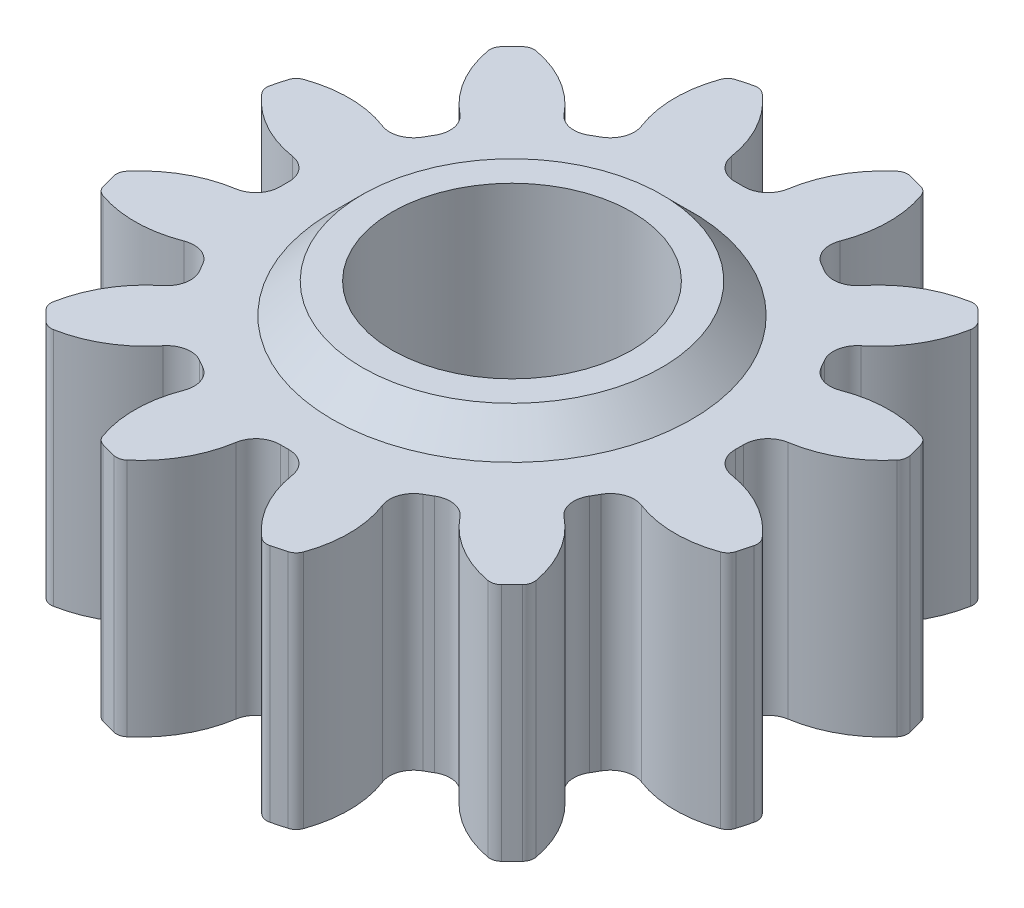
from build123d import *

# Parameters (mm, degrees)
SKETCH1_R            = 5.5
SKETCH1_R_2          = 2
BOSS_EXTRUDE1_DEPTH  = 4
CUT_EXTRUDE1_DEPTH   = 4
FILLET1_R            = 0.2
FILLET2_R            = 0.4
FILLET1_OF_MIRROR1_R = 0.2
FILLET2_OF_MIRROR1_R = 0.4
CIRPATTERN1_DEPTH    = 4
SKETCH3_R            = 3
SKETCH3_R_2          = 2
BOSS_EXTRUDE2_DEPTH  = 0.5
CHAMFER1_SIZE        = 0.5
BOSS_EXTRUDE3_START  = 0.5
SKETCH4_R            = 3
SKETCH4_R_2          = 2
BOSS_EXTRUDE3_DEPTH  = 0.5
CHAMFER2_SIZE        = 0.5


# Read off the part's stored shape, not the designer's step: CirPattern1
with BuildPart() as part:
    # Sketch1 → Boss-Extrude1 (new body)
    with BuildSketch(Plane(origin=(0, 0, 0), x_dir=(1, 0, 0), z_dir=(0, 1, 0))):
        with Locations(Location((0, 0, 0), (0, 0, 270))):
            Circle(SKETCH1_R)
        with Locations(Location((0, 0, 0), (0, 0, 270))):
            Circle(SKETCH1_R_2, mode=Mode.SUBTRACT)
    extrude(amount=BOSS_EXTRUDE1_DEPTH)

    # Sketch2 → Cut-Extrude1 (cut)
    with BuildSketch(Plane(origin=(0, 4, 0), x_dir=(1, 0, 0), z_dir=(0, 1, 0))):
        with BuildLine():
            Line((0, 3.799), (0, 7.477315916))
            Line((0, 7.477315916), (-1.717756705, 5.644784223))
            ThreePointArc((-1.717756705, 5.644784223), (-0.778860554, 4.915006115), (-0.449816676, 3.772275965))
            ThreePointArc((-0.449816676, 3.772275965), (-0.225304913, 3.792313106), (0, 3.799))
        make_face()
    cut_extrude1 = extrude(amount=-CUT_EXTRUDE1_DEPTH, mode=Mode.SUBTRACT)

    # Fillet1
    fillet1_edges = [part.edges().sort_by_distance(p)[0] for p in [
        (-1.205722077, 2, -5.366212284),
    ]]
    fillet(fillet1_edges, radius=FILLET1_R)

    # Fillet2
    fillet2_edges = [part.edges().sort_by_distance(p)[0] for p in [
        (-0.449816676, 2, -3.772275965),
    ]]
    fillet(fillet2_edges, radius=FILLET2_R)

    # Mirror1: Cut-Extrude1 across plane
    add(cut_extrude1.mirror(Plane.ZY), mode=Mode.SUBTRACT)

    # Fillet1 of Mirror1
    fillet1_of_mirror1_edges = [part.edges().sort_by_distance(p)[0] for p in [
        (1.205722077, 2, -5.366212284),
    ]]
    fillet(fillet1_of_mirror1_edges, radius=FILLET1_OF_MIRROR1_R)

    # Fillet2 of Mirror1
    fillet2_of_mirror1_edges = [part.edges().sort_by_distance(p)[0] for p in [
        (0.449816676, 2, -3.772275965),
    ]]
    fillet(fillet2_of_mirror1_edges, radius=FILLET2_OF_MIRROR1_R)

    # CirPattern1 outline → CirPattern1 (cut)
    with BuildSketch(Plane(origin=(0, 0, 0), x_dir=(1, 0, 0), z_dir=(0, 1, 0))):
        with BuildLine():
            ThreePointArc((3.62556251, 4.028637884), (3.71888228, 4.023485264), (3.799671329, 3.976493152))
            ThreePointArc((3.799671329, 3.976493152), (2.75, 4.76313972), (1.543908423, 5.278858473))
            ThreePointArc((1.543908423, 5.278858473), (1.62499931, 5.23238916), (1.676121495, 5.154148179))
            ThreePointArc((1.676121495, 5.154148179), (1.787762124, 4.48460755), (1.659448371, 3.81806133))
            ThreePointArc((1.659448371, 3.81806133), (1.656771541, 3.537498856), (1.839050027, 3.32419855))
            ThreePointArc((1.839050027, 3.32419855), (1.8995, 3.290030509), (1.959315378, 3.254763317))
            ThreePointArc((1.959315378, 3.254763317), (2.235178105, 3.203555671), (2.47681392, 3.34615511))
            ThreePointArc((2.47681392, 3.34615511), (2.989903003, 3.79055119), (3.62556251, 4.028637884))
        make_face()
        with BuildLine():
            ThreePointArc((5.154148179, 1.676121495), (5.23238916, 1.62499931), (5.278858473, 1.543908423))
            ThreePointArc((5.278858473, 1.543908423), (4.763139721, 2.75), (3.976493152, 3.799671329))
            ThreePointArc((3.976493152, 3.799671329), (4.023485264, 3.71888228), (4.028637884, 3.62556251))
            ThreePointArc((4.028637884, 3.62556251), (3.79055119, 2.989903003), (3.34615511, 2.47681392))
            ThreePointArc((3.34615511, 2.47681392), (3.203555671, 2.235178105), (3.254763317, 1.959315378))
            ThreePointArc((3.254763317, 1.959315378), (3.290030509, 1.8995), (3.32419855, 1.839050027))
            ThreePointArc((3.32419855, 1.839050027), (3.537498856, 1.656771541), (3.81806133, 1.659448371))
            ThreePointArc((3.81806133, 1.659448371), (4.48460755, 1.787762124), (5.154148179, 1.676121495))
        make_face()
        with BuildLine():
            ThreePointArc((5.301684005, -1.125510295), (5.34388159, -1.208903897), (5.343579752, -1.302365321))
            ThreePointArc((5.343579752, -1.302365321), (5.5, 0), (5.343579752, 1.302365321))
            ThreePointArc((5.343579752, 1.302365321), (5.34388159, 1.208903897), (5.301684005, 1.125510295))
            ThreePointArc((5.301684005, 1.125510295), (4.777665126, 0.69405636), (4.13626229, 0.47190622))
            ThreePointArc((4.13626229, 0.47190622), (3.891949646, 0.333943185), (3.798365405, 0.069435233))
            ThreePointArc((3.798365405, 0.069435233), (3.799, 0), (3.798365405, -0.069435233))
            ThreePointArc((3.798365405, -0.069435233), (3.891949646, -0.333943185), (4.13626229, -0.47190622))
            ThreePointArc((4.13626229, -0.47190622), (4.777665126, -0.69405636), (5.301684005, -1.125510295))
        make_face()
        with BuildLine():
            ThreePointArc((4.028637884, -3.62556251), (4.023485264, -3.71888228), (3.976493152, -3.799671329))
            ThreePointArc((3.976493152, -3.799671329), (4.763139721, -2.75), (5.278858473, -1.543908423))
            ThreePointArc((5.278858473, -1.543908423), (5.23238916, -1.62499931), (5.154148179, -1.676121495))
            ThreePointArc((5.154148179, -1.676121495), (4.48460755, -1.787762124), (3.81806133, -1.659448371))
            ThreePointArc((3.81806133, -1.659448371), (3.537498856, -1.656771541), (3.32419855, -1.839050027))
            ThreePointArc((3.32419855, -1.839050027), (3.290030509, -1.8995), (3.254763317, -1.959315378))
            ThreePointArc((3.254763317, -1.959315378), (3.203555671, -2.235178105), (3.34615511, -2.47681392))
            ThreePointArc((3.34615511, -2.47681392), (3.79055119, -2.989903003), (4.028637884, -3.62556251))
        make_face()
        with BuildLine():
            ThreePointArc((1.676121495, -5.154148179), (1.62499931, -5.23238916), (1.543908423, -5.278858473))
            ThreePointArc((1.543908423, -5.278858473), (2.75, -4.763139721), (3.799671329, -3.976493152))
            ThreePointArc((3.799671329, -3.976493152), (3.71888228, -4.023485264), (3.62556251, -4.028637884))
            ThreePointArc((3.62556251, -4.028637884), (2.989903003, -3.79055119), (2.47681392, -3.34615511))
            ThreePointArc((2.47681392, -3.34615511), (2.235178105, -3.203555671), (1.959315378, -3.254763317))
            ThreePointArc((1.959315378, -3.254763317), (1.8995, -3.290030509), (1.839050027, -3.32419855))
            ThreePointArc((1.839050027, -3.32419855), (1.656771541, -3.537498856), (1.659448371, -3.81806133))
            ThreePointArc((1.659448371, -3.81806133), (1.787762124, -4.48460755), (1.676121495, -5.154148179))
        make_face()
        with BuildLine():
            ThreePointArc((-1.125510295, -5.301684005), (-1.208903897, -5.34388159), (-1.302365321, -5.343579752))
            ThreePointArc((-1.302365321, -5.343579752), (0, -5.5), (1.302365321, -5.343579752))
            ThreePointArc((1.302365321, -5.343579752), (1.208903897, -5.34388159), (1.125510295, -5.301684005))
            ThreePointArc((1.125510295, -5.301684005), (0.69405636, -4.777665126), (0.47190622, -4.13626229))
            ThreePointArc((0.47190622, -4.13626229), (0.333943185, -3.891949646), (0.069435233, -3.798365405))
            ThreePointArc((0.069435233, -3.798365405), (0, -3.799), (-0.069435233, -3.798365405))
            ThreePointArc((-0.069435233, -3.798365405), (-0.333943185, -3.891949646), (-0.47190622, -4.13626229))
            ThreePointArc((-0.47190622, -4.13626229), (-0.69405636, -4.777665126), (-1.125510295, -5.301684005))
        make_face()
        with BuildLine():
            ThreePointArc((-3.62556251, -4.028637884), (-3.71888228, -4.023485264), (-3.799671329, -3.976493152))
            ThreePointArc((-3.799671329, -3.976493152), (-2.75, -4.763139721), (-1.543908423, -5.278858473))
            ThreePointArc((-1.543908423, -5.278858473), (-1.62499931, -5.23238916), (-1.676121495, -5.154148179))
            ThreePointArc((-1.676121495, -5.154148179), (-1.787762124, -4.48460755), (-1.659448371, -3.81806133))
            ThreePointArc((-1.659448371, -3.81806133), (-1.656771541, -3.537498856), (-1.839050027, -3.32419855))
            ThreePointArc((-1.839050027, -3.32419855), (-1.8995, -3.290030509), (-1.959315378, -3.254763317))
            ThreePointArc((-1.959315378, -3.254763317), (-2.235178105, -3.203555671), (-2.47681392, -3.34615511))
            ThreePointArc((-2.47681392, -3.34615511), (-2.989903003, -3.79055119), (-3.62556251, -4.028637884))
        make_face()
        with BuildLine():
            ThreePointArc((-5.154148179, -1.676121495), (-5.23238916, -1.62499931), (-5.278858473, -1.543908423))
            ThreePointArc((-5.278858473, -1.543908423), (-4.763139721, -2.75), (-3.976493152, -3.799671329))
            ThreePointArc((-3.976493152, -3.799671329), (-4.023485264, -3.71888228), (-4.028637884, -3.62556251))
            ThreePointArc((-4.028637884, -3.62556251), (-3.79055119, -2.989903003), (-3.34615511, -2.47681392))
            ThreePointArc((-3.34615511, -2.47681392), (-3.203555671, -2.235178105), (-3.254763317, -1.959315378))
            ThreePointArc((-3.254763317, -1.959315378), (-3.290030509, -1.8995), (-3.32419855, -1.839050027))
            ThreePointArc((-3.32419855, -1.839050027), (-3.537498856, -1.656771541), (-3.81806133, -1.659448371))
            ThreePointArc((-3.81806133, -1.659448371), (-4.48460755, -1.787762124), (-5.154148179, -1.676121495))
        make_face()
        with BuildLine():
            ThreePointArc((-5.301684005, 1.125510295), (-5.34388159, 1.208903897), (-5.343579752, 1.302365321))
            ThreePointArc((-5.343579752, 1.302365321), (-5.5, 0), (-5.343579752, -1.302365321))
            ThreePointArc((-5.343579752, -1.302365321), (-5.34388159, -1.208903897), (-5.301684005, -1.125510295))
            ThreePointArc((-5.301684005, -1.125510295), (-4.777665126, -0.69405636), (-4.13626229, -0.47190622))
            ThreePointArc((-4.13626229, -0.47190622), (-3.891949646, -0.333943185), (-3.798365405, -0.069435233))
            ThreePointArc((-3.798365405, -0.069435233), (-3.799, 0), (-3.798365405, 0.069435233))
            ThreePointArc((-3.798365405, 0.069435233), (-3.891949646, 0.333943185), (-4.13626229, 0.47190622))
            ThreePointArc((-4.13626229, 0.47190622), (-4.777665126, 0.69405636), (-5.301684005, 1.125510295))
        make_face()
        with BuildLine():
            ThreePointArc((-4.028637884, 3.62556251), (-4.023485264, 3.71888228), (-3.976493152, 3.799671329))
            ThreePointArc((-3.976493152, 3.799671329), (-4.763139721, 2.75), (-5.278858473, 1.543908423))
            ThreePointArc((-5.278858473, 1.543908423), (-5.23238916, 1.62499931), (-5.154148179, 1.676121495))
            ThreePointArc((-5.154148179, 1.676121495), (-4.48460755, 1.787762124), (-3.81806133, 1.659448371))
            ThreePointArc((-3.81806133, 1.659448371), (-3.537498856, 1.656771541), (-3.32419855, 1.839050027))
            ThreePointArc((-3.32419855, 1.839050027), (-3.290030509, 1.8995), (-3.254763317, 1.959315378))
            ThreePointArc((-3.254763317, 1.959315378), (-3.203555671, 2.235178105), (-3.34615511, 2.47681392))
            ThreePointArc((-3.34615511, 2.47681392), (-3.79055119, 2.989903003), (-4.028637884, 3.62556251))
        make_face()
        with BuildLine():
            ThreePointArc((-1.959315378, 3.254763317), (-1.8995, 3.290030509), (-1.839050027, 3.32419855))
            ThreePointArc((-1.839050027, 3.32419855), (-1.656771541, 3.537498856), (-1.659448371, 3.81806133))
            ThreePointArc((-1.659448371, 3.81806133), (-1.787762124, 4.48460755), (-1.676121495, 5.154148179))
            ThreePointArc((-1.676121495, 5.154148179), (-1.62499931, 5.23238916), (-1.543908423, 5.278858473))
            ThreePointArc((-1.543908423, 5.278858473), (-2.75, 4.76313972), (-3.799671329, 3.976493152))
            ThreePointArc((-3.799671329, 3.976493152), (-3.71888228, 4.023485264), (-3.62556251, 4.028637884))
            ThreePointArc((-3.62556251, 4.028637884), (-2.989903003, 3.79055119), (-2.47681392, 3.34615511))
            ThreePointArc((-2.47681392, 3.34615511), (-2.235178105, 3.203555671), (-1.959315378, 3.254763317))
        make_face()
    extrude(amount=CIRPATTERN1_DEPTH, mode=Mode.SUBTRACT)

    # Sketch3 → Boss-Extrude2 (add)
    with BuildSketch(Plane(origin=(0, 4, 0), x_dir=(1, 0, 0), z_dir=(0, 1, 0))):
        with Locations(Location((0, 0, 0), (0, 0, 270))):
            Circle(SKETCH3_R)
        with Locations(Location((0, 0, 0), (0, 0, 270))):
            Circle(SKETCH3_R_2, mode=Mode.SUBTRACT)
    extrude(amount=BOSS_EXTRUDE2_DEPTH)

    # Chamfer1
    chamfer1_edges = [part.edges().sort_by_distance(p)[0] for p in [
        (0, 4.5, -3),
    ]]
    chamfer(chamfer1_edges, length=CHAMFER1_SIZE - 0.0001)  # a hair under: the kernel refuses the full size

    # Sketch4 → Boss-Extrude3 (add)
    with BuildSketch(Plane.XZ.offset(BOSS_EXTRUDE3_START)):
        with Locations(Location((0, 0, 0), (0, 0, 90))):
            Circle(SKETCH4_R)
        with Locations(Location((0, 0, 0), (0, 0, 270))):
            Circle(SKETCH4_R_2, mode=Mode.SUBTRACT)
    extrude(amount=-BOSS_EXTRUDE3_DEPTH)

    # Chamfer2
    chamfer2_edges = [part.edges().sort_by_distance(p)[0] for p in [
        (0, -0.5, -3),
    ]]
    chamfer(chamfer2_edges, length=CHAMFER2_SIZE - 0.0001)  # a hair under: the kernel refuses the full size


solid = part.part
